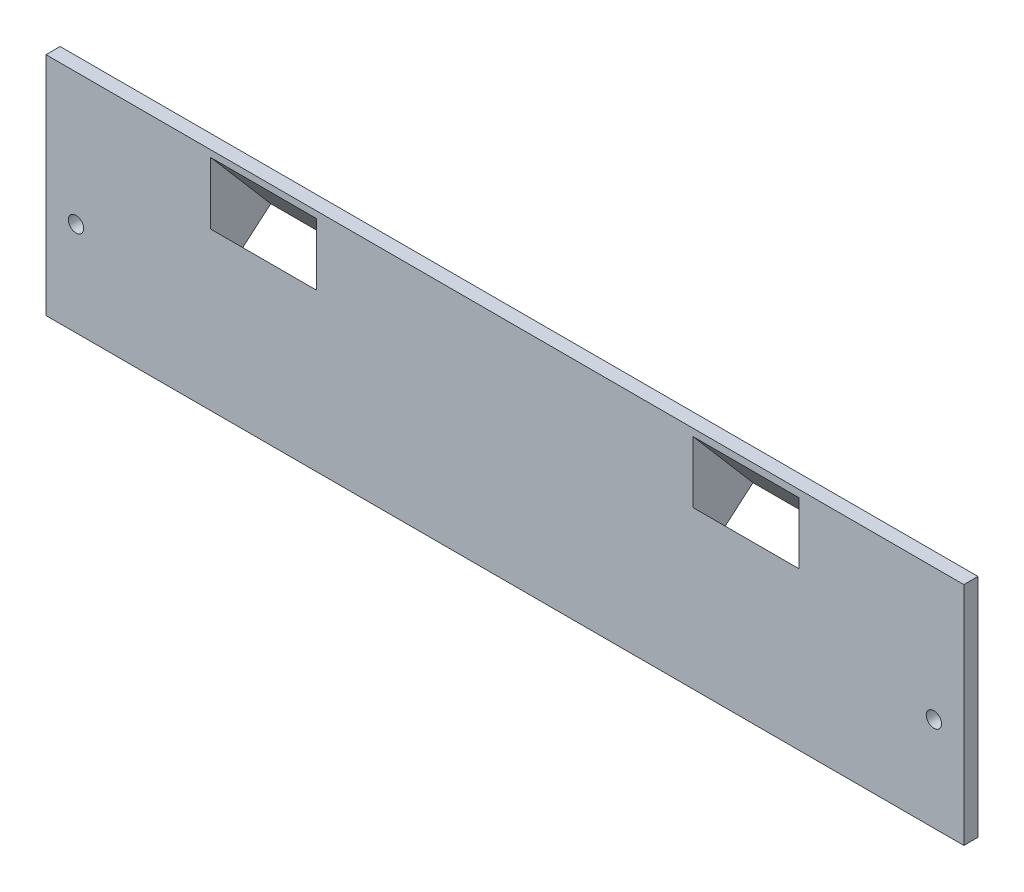
from build123d import *

# Parameters (mm, degrees)
CROQUIS1_W                 = 195
CROQUIS1_H                 = 38
CROQUIS1_R                 = 1.625
SALIENTE_EXTRUIR1_DEPTH    = 3
CROQUIS8_W                 = 195
CROQUIS8_H                 = 3
SALIENTE_EXTRUIR5_DEPTH    = 5
CROQUIS9_W                 = 195
CROQUIS9_H                 = 3
SALIENTE_EXTRUIR6_DEPTH    = 5
SALIENTE_EXTRUIR7_START    = -25
SALIENTE_EXTRUIR7_DEPTH    = 35
CORTAR_EXTRUIR4_DEPTH      = 105.824060679
CORTAR_EXTRUIR4_DEPTH_BACK = 105.824060679
CROQUIS11_W                = 22.5
CROQUIS11_H                = 8.5
CORTAR_EXTRUIR5_REACH      = 177.705
CROQUIS13_R                = 1
CORTAR_EXTRUIR6_DEPTH      = 5
SALIENTE_EXTRUIR8_START    = -25
SALIENTE_EXTRUIR8_DEPTH    = 35
CORTAR_EXTRUIR7_DEPTH      = 104.684959426
CORTAR_EXTRUIR7_DEPTH_BACK = 104.684959426
CROQUIS16_W                = 22.5
CROQUIS16_H                = 8.572274099
CROQUIS17_R                = 1
CORTAR_EXTRUIR8_DEPTH      = 5
SALIENTE_EXTRUIR9_REACH    = 109.685
SALIENTE_EXTRUIR9_START    = 4
CROQUIS18_W                = 35
CROQUIS18_H                = 12
CROQUIS18_R                = 1
CROQUIS18_W_2              = 22.5
CROQUIS18_H_2              = 8.572274099
CROQUIS18_H_3              = 8.5


with BuildPart() as part:
    # Croquis1 → Saliente-Extruir1 (new body)
    with BuildSketch(Plane.XY):
        with Locations((0, 19)):
            Rectangle(CROQUIS1_W, CROQUIS1_H)
        with Locations((91.125, 15)):
            Circle(CROQUIS1_R, mode=Mode.SUBTRACT)
        with Locations((-91.125, 15)):
            Circle(CROQUIS1_R, mode=Mode.SUBTRACT)
    extrude(amount=SALIENTE_EXTRUIR1_DEPTH)

    # Croquis8 → Saliente-Extruir5 (add)
    with BuildSketch(Plane.XZ):
        with Locations((0, 1.5)):
            Rectangle(CROQUIS8_W, CROQUIS8_H)
    extrude(amount=SALIENTE_EXTRUIR5_DEPTH)

    # Croquis9 → Saliente-Extruir6 (add)
    with BuildSketch(Plane(origin=(0, 38, 0), x_dir=(1, 0, 0), z_dir=(0, 1, 0))):
        with Locations((0, -1.5)):
            Rectangle(CROQUIS9_W, CROQUIS9_H)
    extrude(amount=SALIENTE_EXTRUIR6_DEPTH)

    # Croquis10 → Saliente-Extruir7 (add)
    with BuildSketch(Plane(origin=(97.5, 0, 0), x_dir=(0, 0, -1), z_dir=(1, 0, 0)).offset(SALIENTE_EXTRUIR7_START)):
        Polygon((0, 39.499839942), (11.100559408, 26.548595056), (1.230032412, 18.088530231), (0, 17.034264947), align=None)
    extrude(amount=-SALIENTE_EXTRUIR7_DEPTH)

    # Croquis11 → Cortar-Extruir4 (cut, two sides: drawn at the far end of the back side and taken through both)
    with BuildSketch(Plane(origin=(0, 9.820133108, 8.416872039), x_dir=(1, 0, 0), z_dir=(0, -0.7592713073348797, -0.6507742172658522)).offset(-CORTAR_EXTRUIR4_DEPTH_BACK)):
        with Locations((51.25, -20.45547742)):
            Rectangle(CROQUIS11_W, CROQUIS11_H)
    extrude(amount=CORTAR_EXTRUIR4_DEPTH + CORTAR_EXTRUIR4_DEPTH_BACK, mode=Mode.SUBTRACT)

    # Croquis12 → Cortar-Extruir5 (cut, up to next)
    with BuildSketch(Plane(origin=(72.5, 0, 0), x_dir=(0, 0, -1), z_dir=(1, 0, 0)), mode=Mode.PRIVATE) as cortar_extruir5_sk1:
        Polygon((11.100559408, 26.548595056), (0, 17.034264947), (0, 23.619526305), (7.846688321, 30.344951592), align=None)
    cortar_extruir5_tool1 = extrude(cortar_extruir5_sk1.sketch, amount=-CORTAR_EXTRUIR5_REACH, mode=Mode.PRIVATE) & part.part
    add(cortar_extruir5_tool1.solids().sort_by_distance((72.5, 24.238262, -4.783378))[0], mode=Mode.SUBTRACT)

    # Croquis13 → Cortar-Extruir6 (cut)
    with BuildSketch(Plane(origin=(0, 13.616489645, 11.670743125), x_dir=(1, 0, 0), z_dir=(0, -0.7592713073348788, -0.6507742172658535))):
        with Locations((66.25, -20.20547742)):
            Circle(CROQUIS13_R)
    extrude(amount=-CORTAR_EXTRUIR6_DEPTH, mode=Mode.SUBTRACT)

    # Croquis14 → Saliente-Extruir8 (add)
    with BuildSketch(Plane.ZY.offset(97.5).offset(SALIENTE_EXTRUIR8_START)):
        Polygon((0, 23.619526305), (-7.846688321, 30.344951592), (0, 39.499839942), align=None)
    extrude(amount=-SALIENTE_EXTRUIR8_DEPTH)

    # Croquis16 → Cortar-Extruir7 (cut, two sides: drawn at the far end of the back side and taken through both)
    with BuildSketch(Plane(origin=(0, 13.616489645, 11.670743125), x_dir=(1, 0, 0), z_dir=(0, -0.7592713073348788, -0.6507742172658535)).offset(-CORTAR_EXTRUIR7_DEPTH_BACK)):
        with Locations((-51.25, -20.491614469)):
            Rectangle(CROQUIS16_W, CROQUIS16_H)
    extrude(amount=CORTAR_EXTRUIR7_DEPTH + CORTAR_EXTRUIR7_DEPTH_BACK, mode=Mode.SUBTRACT)

    # Croquis17 → Cortar-Extruir8 (cut)
    with BuildSketch(Plane(origin=(0, 13.616489645, 11.670743125), x_dir=(1, 0, 0), z_dir=(0, -0.7592713073348788, -0.6507742172658535))):
        with Locations((-66.25, -20.20547742)):
            Circle(CROQUIS17_R)
    extrude(amount=-CORTAR_EXTRUIR8_DEPTH, mode=Mode.SUBTRACT)

    # Saliente-Extruir9: up to this plane
    saliente_extruir9_end = Plane(origin=(0, 0, 0), z_dir=(0, 0, 1))
    # Croquis18 → Saliente-Extruir9 (add, up to the surface)
    with BuildSketch(Plane(origin=(0, 13.616489645, 11.670743125), x_dir=(1, 0, 0), z_dir=(0, -0.7592713073348788, -0.6507742172658535)).offset(SALIENTE_EXTRUIR9_START), mode=Mode.PRIVATE) as saliente_extruir9_sk1:
        with Locations((-55, -19.70547742)):
            Rectangle(CROQUIS18_W, CROQUIS18_H)
        with Locations((-66.25, -20.20547742)):
            Circle(CROQUIS18_R, mode=Mode.SUBTRACT)
        with Locations((-51.25, -20.491614469)):
            Rectangle(CROQUIS18_W_2, CROQUIS18_H_2, mode=Mode.SUBTRACT)
    saliente_extruir9_tool1 = split(extrude(saliente_extruir9_sk1.sketch, amount=-SALIENTE_EXTRUIR9_REACH, mode=Mode.PRIVATE), bisect_by=saliente_extruir9_end, keep=Keep.BOTH, mode=Mode.PRIVATE)
    add(saliente_extruir9_tool1.solids().sort_by_distance((-55, 27.06708, -10.168855))[0])
    # Croquis18 → Saliente-Extruir9 (add, up to the surface)
    with BuildSketch(Plane(origin=(0, 13.616489645, 11.670743125), x_dir=(1, 0, 0), z_dir=(0, -0.7592713073348788, -0.6507742172658535)).offset(SALIENTE_EXTRUIR9_START), mode=Mode.PRIVATE) as saliente_extruir9_sk2:
        with Locations((55, -19.70547742)):
            Rectangle(CROQUIS18_W, CROQUIS18_H)
        with Locations((66.25, -20.20547742)):
            Circle(CROQUIS18_R, mode=Mode.SUBTRACT)
        with Locations((51.25, -20.45547742)):
            Rectangle(CROQUIS18_W_2, CROQUIS18_H_3, mode=Mode.SUBTRACT)
    saliente_extruir9_tool2 = split(extrude(saliente_extruir9_sk2.sketch, amount=-SALIENTE_EXTRUIR9_REACH, mode=Mode.PRIVATE), bisect_by=saliente_extruir9_end, keep=Keep.BOTH, mode=Mode.PRIVATE)
    add(saliente_extruir9_tool2.solids().sort_by_distance((55, 27.06708, -10.168855))[0])


solid = part.part
